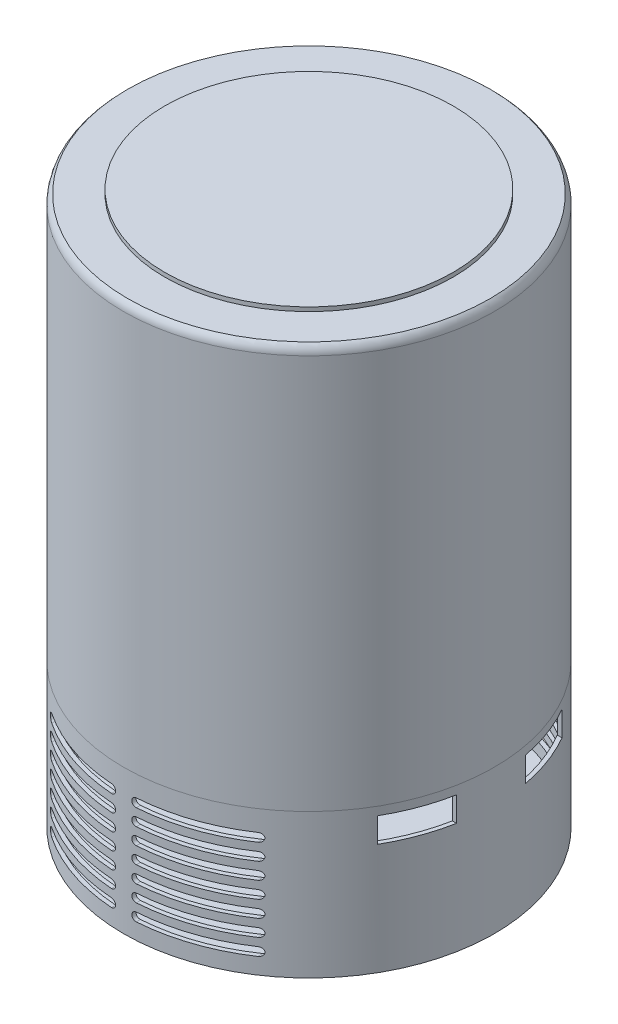
from build123d import *

# Parameters (mm, degrees)
SKETCH1_R           = 45
SKETCH1_R_2         = 44
BOSS_EXTRUDE1_DEPTH = 98
FILLET1_R           = 3
BOSS_EXTRUDE9_START = 96
SKETCH13_R          = 44
BOSS_EXTRUDE9_DEPTH = 2
SKETCH5_R           = 45
BOSS_EXTRUDE6_DEPTH = 35
CUT_EXTRUDE2_START  = -34
SKETCH6_R           = 44
CUT_EXTRUDE2_DEPTH  = 34
SKETCH7_R           = 35
BOSS_EXTRUDE7_DEPTH = 1
CUT_EXTRUDE3_START  = -39
SKETCH8_W           = 8
SKETCH8_H           = 3.5
CUT_EXTRUDE3_DEPTH  = 79.690271476
CUT_EXTRUDE5_START  = -36
CUT_EXTRUDE5_DEPTH  = 10
CUT_EXTRUDE6_START  = 46
CUT_EXTRUDE6_DEPTH  = 10
CUT_EXTRUDE7_START  = 36
SKETCH14_W          = 14
SKETCH14_H          = 6
CUT_EXTRUDE7_DEPTH  = 10


with BuildPart() as part:
    # Sketch1 → Boss-Extrude1 (new body)
    with BuildSketch(Plane(origin=(0, 0, 0), x_dir=(1, 0, 0), z_dir=(0, 1, 0))):
        with Locations(Location((0, 0, 0), (0, 0, 270))):
            Circle(SKETCH1_R)
        with Locations(Location((0, 0, 0), (0, 0, 270))):
            Circle(SKETCH1_R_2, mode=Mode.SUBTRACT)
    extrude(amount=BOSS_EXTRUDE1_DEPTH)

    # Fillet1
    # the kernel refuses this fillet: 3 mm, written as the material it takes off along each edge
    with BuildSketch(Plane(origin=(0, 98, 0), x_dir=(0, 0, 1), z_dir=(-1, 0, 0))) as fillet1_piece_1:
        with BuildLine():
            CenterArc((42, -2.236067977), FILLET1_R, 0, 48.189685104)
            Line((44, 0), (44.04, 0.04472136))
            ThreePointArc((44.04, 0.04472136), (44.5, 0.06), (45, 0.06))
            Line((45, 0.06), (45.06, 0))
            Line((45.06, 0), (45.06, -2.236067977))
            Line((45.06, -2.236067977), (45, -2.236067977))
        make_face()
    revolve(axis=Axis((0, 98, 0), (0, 1, 0)), mode=Mode.SUBTRACT)

    # Sketch13 → Boss-Extrude9 (add)
    with BuildSketch(Plane(origin=(0, 0, 0), x_dir=(1, 0, 0), z_dir=(0, 1, 0)).offset(BOSS_EXTRUDE9_START)):
        with Locations(Location((0, 0, 0), (0, 0, 270))):
            Circle(SKETCH13_R)
    extrude(amount=BOSS_EXTRUDE9_DEPTH)

    # Sketch7 → Boss-Extrude7 (add)
    with BuildSketch(Plane(origin=(0, 98, 0), x_dir=(1, 0, 0), z_dir=(0, 1, 0))):
        with Locations(Location((0, 0, 0), (0, 0, 270))):
            Circle(SKETCH7_R)
    extrude(amount=BOSS_EXTRUDE7_DEPTH)


with BuildPart() as body_2:
    # Sketch5 → Boss-Extrude6 (new body)
    with BuildSketch(Plane(origin=(0, 0, 0), x_dir=(1, 0, 0), z_dir=(0, 1, 0))):
        with Locations(Location((0, 0, 0), (0, 0, 270))):
            Circle(SKETCH5_R)
    extrude(amount=-BOSS_EXTRUDE6_DEPTH)

    # Sketch6 → Cut-Extrude2 (cut)
    with BuildSketch(Plane(origin=(0, 0, 0), x_dir=(1, 0, 0), z_dir=(0, 1, 0)).offset(CUT_EXTRUDE2_START)):
        with Locations(Location((0, 0, 0), (0, 0, 270))):
            Circle(SKETCH6_R)
    extrude(amount=CUT_EXTRUDE2_DEPTH, mode=Mode.SUBTRACT)

    # Sketch8 → Cut-Extrude3 (cut, through all)
    with BuildSketch(Plane(origin=(0, 0, 0), x_dir=(0, 0, -1), z_dir=(1, 0, 0)).offset(CUT_EXTRUDE3_START)):
        with Locations((0, -3.75)):
            Rectangle(SKETCH8_W, SKETCH8_H)
    extrude(amount=-CUT_EXTRUDE3_DEPTH, mode=Mode.SUBTRACT)

    # Sketch10 → Cut-Extrude5 (cut)
    with BuildSketch(Plane.XY.offset(CUT_EXTRUDE5_START)):
        with BuildLine():
            Line((25, -5), (3, -5))
            ThreePointArc((3, -5), (1.971196539, -6.028803461), (3, -7.057606922))
            Line((3, -7.057606922), (25, -7.057606922))
            ThreePointArc((25, -7.057606922), (26.028803461, -6.028803461), (25, -5))
        make_face()
        with BuildLine():
            Line((-25, -5), (-3, -5))
            ThreePointArc((-3, -5), (-1.971196539, -6.028803461), (-3, -7.057606922))
            Line((-3, -7.057606922), (-25, -7.057606922))
            ThreePointArc((-25, -7.057606922), (-26.028803461, -6.028803461), (-25, -5))
        make_face()
        with BuildLine():
            Line((-25, -9), (-3, -9))
            ThreePointArc((-3, -9), (-1.971196539, -10.028803461), (-3, -11.057606922))
            Line((-3, -11.057606922), (-25, -11.057606922))
            ThreePointArc((-25, -11.057606922), (-26.028803461, -10.028803461), (-25, -9))
        make_face()
        with BuildLine():
            Line((25, -9), (3, -9))
            ThreePointArc((3, -9), (1.971196539, -10.028803461), (3, -11.057606922))
            Line((3, -11.057606922), (25, -11.057606922))
            ThreePointArc((25, -11.057606922), (26.028803461, -10.028803461), (25, -9))
        make_face()
        with BuildLine():
            Line((-25, -13), (-3, -13))
            ThreePointArc((-3, -13), (-1.971196539, -14.028803461), (-3, -15.057606922))
            Line((-3, -15.057606922), (-25, -15.057606922))
            ThreePointArc((-25, -15.057606922), (-26.028803461, -14.028803461), (-25, -13))
        make_face()
        with BuildLine():
            Line((25, -13), (3, -13))
            ThreePointArc((3, -13), (1.971196539, -14.028803461), (3, -15.057606922))
            Line((3, -15.057606922), (25, -15.057606922))
            ThreePointArc((25, -15.057606922), (26.028803461, -14.028803461), (25, -13))
        make_face()
        with BuildLine():
            Line((-25, -17), (-3, -17))
            ThreePointArc((-3, -17), (-1.971196539, -18.028803461), (-3, -19.057606922))
            Line((-3, -19.057606922), (-25, -19.057606922))
            ThreePointArc((-25, -19.057606922), (-26.028803461, -18.028803461), (-25, -17))
        make_face()
        with BuildLine():
            Line((25, -17), (3, -17))
            ThreePointArc((3, -17), (1.971196539, -18.028803461), (3, -19.057606922))
            Line((3, -19.057606922), (25, -19.057606922))
            ThreePointArc((25, -19.057606922), (26.028803461, -18.028803461), (25, -17))
        make_face()
        with BuildLine():
            Line((-25, -21), (-3, -21))
            ThreePointArc((-3, -21), (-1.971196539, -22.028803461), (-3, -23.057606922))
            Line((-3, -23.057606922), (-25, -23.057606922))
            ThreePointArc((-25, -23.057606922), (-26.028803461, -22.028803461), (-25, -21))
        make_face()
        with BuildLine():
            Line((25, -21), (3, -21))
            ThreePointArc((3, -21), (1.971196539, -22.028803461), (3, -23.057606922))
            Line((3, -23.057606922), (25, -23.057606922))
            ThreePointArc((25, -23.057606922), (26.028803461, -22.028803461), (25, -21))
        make_face()
        with BuildLine():
            Line((-25, -25), (-3, -25))
            ThreePointArc((-3, -25), (-1.971196539, -26.028803461), (-3, -27.057606922))
            Line((-3, -27.057606922), (-25, -27.057606922))
            ThreePointArc((-25, -27.057606922), (-26.028803461, -26.028803461), (-25, -25))
        make_face()
        with BuildLine():
            Line((25, -25), (3, -25))
            ThreePointArc((3, -25), (1.971196539, -26.028803461), (3, -27.057606922))
            Line((3, -27.057606922), (25, -27.057606922))
            ThreePointArc((25, -27.057606922), (26.028803461, -26.028803461), (25, -25))
        make_face()
        with BuildLine():
            Line((-25, -28.999999922), (-3, -28.999999922))
            ThreePointArc((-3, -28.999999922), (-1.971196539, -30.028803383), (-3, -31.057606843))
            Line((-3, -31.057606843), (-25, -31.057606843))
            ThreePointArc((-25, -31.057606843), (-26.028803461, -30.028803383), (-25, -28.999999922))
        make_face()
        with BuildLine():
            Line((25, -28.999999922), (3, -28.999999922))
            ThreePointArc((3, -28.999999922), (1.971196539, -30.028803383), (3, -31.057606843))
            Line((3, -31.057606843), (25, -31.057606843))
            ThreePointArc((25, -31.057606843), (26.028803461, -30.028803383), (25, -28.999999922))
        make_face()
    extrude(amount=-CUT_EXTRUDE5_DEPTH, mode=Mode.SUBTRACT)

    # Sketch12 → Cut-Extrude6 (cut)
    with BuildSketch(Plane.XY.offset(CUT_EXTRUDE6_START)):
        with BuildLine():
            Line((25, -5), (3, -5))
            ThreePointArc((3, -5), (1.971196539, -6.028803461), (3, -7.057606922))
            Line((3, -7.057606922), (25, -7.057606922))
            ThreePointArc((25, -7.057606922), (26.028803461, -6.028803461), (25, -5))
        make_face()
        with BuildLine():
            Line((-25, -5), (-3, -5))
            ThreePointArc((-3, -5), (-1.971196539, -6.028803461), (-3, -7.057606922))
            Line((-3, -7.057606922), (-25, -7.057606922))
            ThreePointArc((-25, -7.057606922), (-26.028803461, -6.028803461), (-25, -5))
        make_face()
        with BuildLine():
            Line((-25, -9), (-3, -9))
            ThreePointArc((-3, -9), (-1.971196539, -10.028803461), (-3, -11.057606922))
            Line((-3, -11.057606922), (-25, -11.057606922))
            ThreePointArc((-25, -11.057606922), (-26.028803461, -10.028803461), (-25, -9))
        make_face()
        with BuildLine():
            Line((25, -9), (3, -9))
            ThreePointArc((3, -9), (1.971196539, -10.028803461), (3, -11.057606922))
            Line((3, -11.057606922), (25, -11.057606922))
            ThreePointArc((25, -11.057606922), (26.028803461, -10.028803461), (25, -9))
        make_face()
        with BuildLine():
            Line((-25, -13), (-3, -13))
            ThreePointArc((-3, -13), (-1.971196539, -14.028803461), (-3, -15.057606922))
            Line((-3, -15.057606922), (-25, -15.057606922))
            ThreePointArc((-25, -15.057606922), (-26.028803461, -14.028803461), (-25, -13))
        make_face()
        with BuildLine():
            Line((25, -13), (3, -13))
            ThreePointArc((3, -13), (1.971196539, -14.028803461), (3, -15.057606922))
            Line((3, -15.057606922), (25, -15.057606922))
            ThreePointArc((25, -15.057606922), (26.028803461, -14.028803461), (25, -13))
        make_face()
        with BuildLine():
            Line((-25, -17), (-3, -17))
            ThreePointArc((-3, -17), (-1.971196539, -18.028803461), (-3, -19.057606922))
            Line((-3, -19.057606922), (-25, -19.057606922))
            ThreePointArc((-25, -19.057606922), (-26.028803461, -18.028803461), (-25, -17))
        make_face()
        with BuildLine():
            Line((25, -17), (3, -17))
            ThreePointArc((3, -17), (1.971196539, -18.028803461), (3, -19.057606922))
            Line((3, -19.057606922), (25, -19.057606922))
            ThreePointArc((25, -19.057606922), (26.028803461, -18.028803461), (25, -17))
        make_face()
        with BuildLine():
            Line((-25, -21), (-3, -21))
            ThreePointArc((-3, -21), (-1.971196539, -22.028803461), (-3, -23.057606922))
            Line((-3, -23.057606922), (-25, -23.057606922))
            ThreePointArc((-25, -23.057606922), (-26.028803461, -22.028803461), (-25, -21))
        make_face()
        with BuildLine():
            Line((25, -21), (3, -21))
            ThreePointArc((3, -21), (1.971196539, -22.028803461), (3, -23.057606922))
            Line((3, -23.057606922), (25, -23.057606922))
            ThreePointArc((25, -23.057606922), (26.028803461, -22.028803461), (25, -21))
        make_face()
        with BuildLine():
            Line((-25, -25), (-3, -25))
            ThreePointArc((-3, -25), (-1.971196539, -26.028803461), (-3, -27.057606922))
            Line((-3, -27.057606922), (-25, -27.057606922))
            ThreePointArc((-25, -27.057606922), (-26.028803461, -26.028803461), (-25, -25))
        make_face()
        with BuildLine():
            Line((25, -25), (3, -25))
            ThreePointArc((3, -25), (1.971196539, -26.028803461), (3, -27.057606922))
            Line((3, -27.057606922), (25, -27.057606922))
            ThreePointArc((25, -27.057606922), (26.028803461, -26.028803461), (25, -25))
        make_face()
        with BuildLine():
            Line((-25, -28.999999922), (-3, -28.999999922))
            ThreePointArc((-3, -28.999999922), (-1.971196539, -30.028803383), (-3, -31.057606843))
            Line((-3, -31.057606843), (-25, -31.057606843))
            ThreePointArc((-25, -31.057606843), (-26.028803461, -30.028803383), (-25, -28.999999922))
        make_face()
        with BuildLine():
            Line((25, -31.057606843), (3, -31.057606843))
            ThreePointArc((3, -31.057606843), (1.971196539, -30.028803383), (3, -28.999999922))
            Line((3, -28.999999922), (25, -28.999999922))
            ThreePointArc((25, -28.999999922), (26.028803461, -30.028803383), (25, -31.057606843))
        make_face()
    extrude(amount=-CUT_EXTRUDE6_DEPTH, mode=Mode.SUBTRACT)

    # Sketch14 → Cut-Extrude7 (cut)
    with BuildSketch(Plane(origin=(0, 0, 0), x_dir=(0, 0, -1), z_dir=(1, 0, 0)).offset(CUT_EXTRUDE7_START)):
        with Locations((-15.39090645, -5)):
            Rectangle(SKETCH14_W, SKETCH14_H)
        with Locations((15.39090645, -5)):
            Rectangle(SKETCH14_W, SKETCH14_H)
    extrude(amount=CUT_EXTRUDE7_DEPTH, mode=Mode.SUBTRACT)


solid = Compound([part.part, body_2.part])
